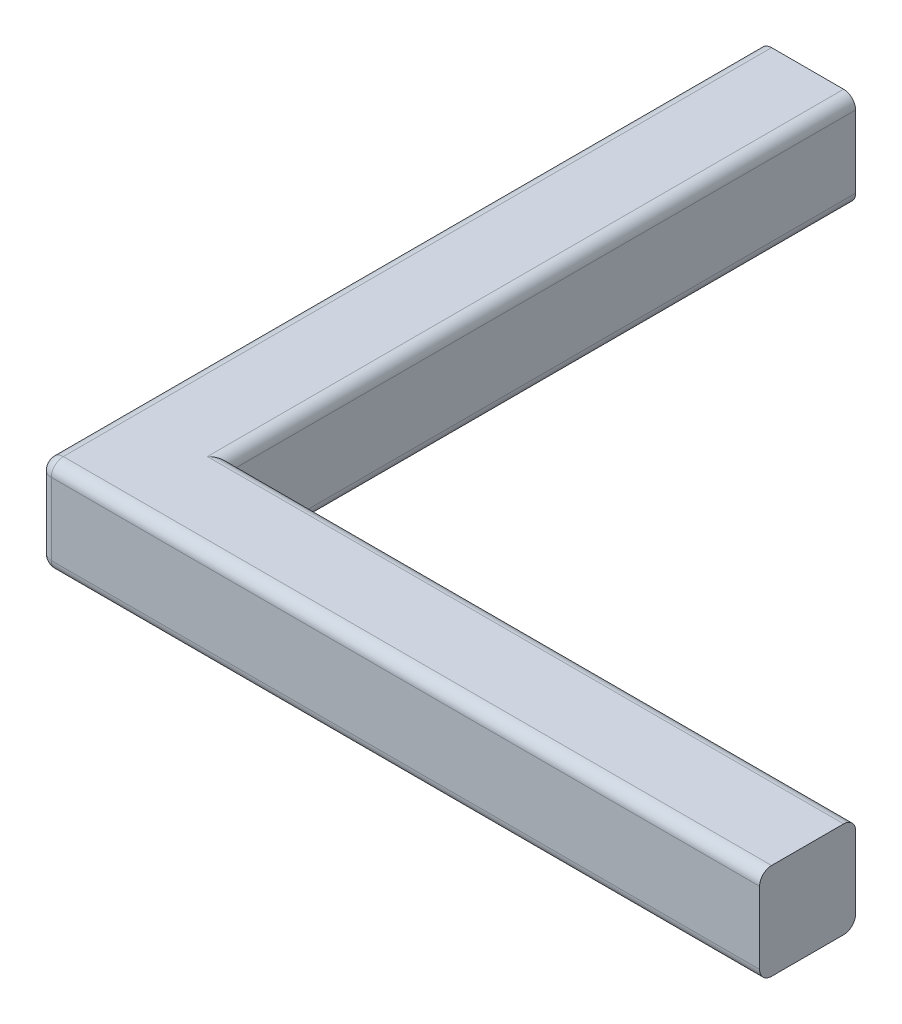
from build123d import *

# Parameters (mm, degrees)
BOSS_EXTRUDE1_DEPTH = 40
FILLET1_R           = 5
FILLET2_R           = 5
FILLET3_R           = 5


with BuildPart() as part:
    # Sketch1 → Boss-Extrude1 (new body)
    with BuildSketch(Plane(origin=(0, 0, 0), x_dir=(1, 0, 0), z_dir=(0, 1, 0))):
        Polygon((0, 0), (300, 0), (300, 40), (40, 40), (40, 300), (0, 300), (0, 40), align=None)
    extrude(amount=BOSS_EXTRUDE1_DEPTH)

    # Fillet1
    fillet1_edges = [part.edges().sort_by_distance(p)[0] for p in [
        (150, 40, 0),
    ]]
    fillet(fillet1_edges, radius=FILLET1_R)

    # Fillet2
    fillet2_edges = [part.edges().sort_by_distance(p)[0] for p in [
        (150, 0, 0),
        (40, 0, -170),
        (40, 40, -170),
        (170, 40, -40),
    ]]
    fillet(fillet2_edges, radius=FILLET2_R)

    # Fillet3
    fillet3_edges = [part.edges().sort_by_distance(p)[0] for p in [
        (0, 1.464466094, -1.464466094),
        (0, 20, 0),
        (0, 38.535533906, -1.464466094),
        (167.5, 0, -40),
        (0, 0, -152.5),
        (0, 40, -152.5),
    ]]
    fillet(fillet3_edges, radius=FILLET3_R)


solid = part.part
